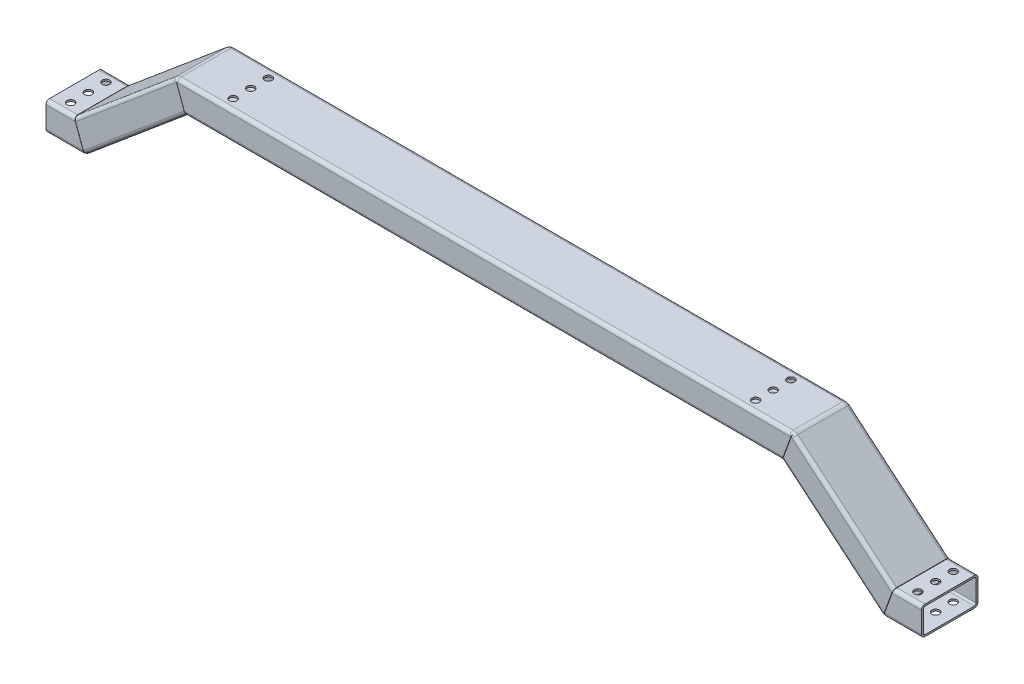
from build123d import *

# Parameters (mm, degrees)
FILLET1_R                    = 6.35
CUT_EXTRUDE_THIN1_DEPTH      = 405.410756534
CUT_EXTRUDE_THIN1_DEPTH_BACK = 405.410756534
F_1_4_CLEARANCE_HOLE1_D      = 6.7564


with BuildPart() as part:
    # Sweep-Thin1: sweep along a path in Sketch1
    with BuildLine(Plane.XY) as sweep_thin1_path:
        Line((-393.7, -76.2), (-363.677578025, -76.2))
        Line((-363.677578025, -76.2), (-272.865954269, 0))
        Line((-272.865954269, 0), (272.865954269, 0))
        Line((272.865954269, 0), (363.677578025, -76.2))
        Line((363.677578025, -76.2), (393.7, -76.2))
    # Sketch2 → Sweep-Thin1 (sweep)
    with BuildSketch(Plane(origin=(-393.7, 0, 0), x_dir=(0, 0, -1), z_dir=(1, 0, 0))):
        with BuildLine():
            Line((-22.225, -63.5), (22.225, -63.5))
            ThreePointArc((22.225, -63.5), (24.47006403, -64.42993597), (25.4, -66.675))
            Line((25.4, -66.675), (25.4, -85.725))
            ThreePointArc((25.4, -85.725), (24.47006403, -87.97006403), (22.225, -88.9))
            Line((22.225, -88.9), (-22.225, -88.9))
            ThreePointArc((-22.225, -88.9), (-24.47006403, -87.97006403), (-25.4, -85.725))
            Line((-25.4, -85.725), (-25.4, -66.675))
            ThreePointArc((-25.4, -66.675), (-24.47006403, -64.42993597), (-22.225, -63.5))
        make_face()
        with BuildLine():
            Line((-22.225, -65.0875), (22.225, -65.0875))
            ThreePointArc((22.225, -65.0875), (23.347532015, -65.552467985), (23.8125, -66.675))
            Line((23.8125, -66.675), (23.8125, -85.725))
            ThreePointArc((23.8125, -85.725), (23.347532015, -86.847532015), (22.225, -87.3125))
            Line((22.225, -87.3125), (-22.225, -87.3125))
            ThreePointArc((-22.225, -87.3125), (-23.347532015, -86.847532015), (-23.8125, -85.725))
            Line((-23.8125, -85.725), (-23.8125, -66.675))
            ThreePointArc((-23.8125, -66.675), (-23.347532015, -65.552467985), (-22.225, -65.0875))
        make_face(mode=Mode.SUBTRACT)
    sweep(path=sweep_thin1_path.line, transition=Transition.RIGHT)

    # Fillet1
    # the kernel refuses this fillet: 6.35 mm, written as the material it takes off along each edge
    with BuildSketch(Plane(origin=(-361.366367037, -82.55, 25.4), x_dir=(0, -1, 0), z_dir=(-1, 0, 0))) as fillet1_piece_1:
        with BuildLine():
            CenterArc((3.175, -3.175), 3.175, 0, 90)
            Line((6.35, -3.175), (6.35, 0))
            Line((6.35, 0), (3.175, 0))
        make_face()
    revolve(axis=Axis((-361.366367037, -82.55, 25.4), (0, 0, 1)), revolution_arc=40, mode=Mode.SUBTRACT)
    with BuildSketch(Plane(origin=(-361.366367037, -82.55, -25.4), x_dir=(0.6427876096865407, -0.7660444431189771, 0), z_dir=(0.7660444431189771, 0.6427876096865407, 0))) as fillet1_piece_2:
        with BuildLine():
            CenterArc((3.175, -3.175), 3.175, 0, 90)
            Line((6.35, -3.175), (6.35, 0))
            Line((6.35, 0), (3.175, 0))
        make_face()
    revolve(axis=Axis((-361.366367037, -82.55, -25.4), (0, 0, -1)), revolution_arc=40, mode=Mode.SUBTRACT)
    with BuildSketch(Plane(origin=(-275.177165257, 6.35, -25.4), x_dir=(-0.6427876096865407, 0.7660444431189771, 0), z_dir=(-0.7660444431189771, -0.6427876096865407, 0))) as fillet1_piece_3:
        with BuildLine():
            CenterArc((3.175, -3.175), 3.175, 0, 90)
            Line((6.35, -3.175), (6.35, 0))
            Line((6.35, 0), (3.175, 0))
        make_face()
    revolve(axis=Axis((-275.177165257, 6.35, -25.4), (0, 0, -1)), revolution_arc=40, mode=Mode.SUBTRACT)
    with BuildSketch(Plane(origin=(-275.177165257, 6.35, 25.4), x_dir=(0, 1, 0), z_dir=(1, 0, 0))) as fillet1_piece_4:
        with BuildLine():
            CenterArc((3.175, -3.175), 3.175, 0, 90)
            Line((6.35, -3.175), (6.35, 0))
            Line((6.35, 0), (3.175, 0))
        make_face()
    revolve(axis=Axis((-275.177165257, 6.35, 25.4), (0, 0, 1)), revolution_arc=40, mode=Mode.SUBTRACT)
    with BuildSketch(Plane(origin=(275.177165257, 6.35, -25.4), x_dir=(0, 1, 0), z_dir=(-1, 0, 0))) as fillet1_piece_5:
        with BuildLine():
            CenterArc((3.175, -3.175), 3.175, 0, 90)
            Line((6.35, -3.175), (6.35, 0))
            Line((6.35, 0), (3.175, 0))
        make_face()
    revolve(axis=Axis((275.177165257, 6.35, -25.4), (0, 0, -1)), revolution_arc=40, mode=Mode.SUBTRACT)
    with BuildSketch(Plane(origin=(275.177165257, 6.35, 25.4), x_dir=(0.6427876096865434, 0.7660444431189747, 0), z_dir=(0.7660444431189747, -0.6427876096865434, 0))) as fillet1_piece_6:
        with BuildLine():
            CenterArc((3.175, -3.175), 3.175, 0, 90)
            Line((6.35, -3.175), (6.35, 0))
            Line((6.35, 0), (3.175, 0))
        make_face()
    revolve(axis=Axis((275.177165257, 6.35, 25.4), (0, 0, 1)), revolution_arc=40, mode=Mode.SUBTRACT)
    with BuildSketch(Plane(origin=(361.366367037, -82.55, -25.4), x_dir=(0, -1, 0), z_dir=(1, 0, 0))) as fillet1_piece_7:
        with BuildLine():
            CenterArc((3.175, -3.175), 3.175, 0, 90)
            Line((6.35, -3.175), (6.35, 0))
            Line((6.35, 0), (3.175, 0))
        make_face()
    revolve(axis=Axis((361.366367037, -82.55, -25.4), (0, 0, -1)), revolution_arc=40, mode=Mode.SUBTRACT)
    with BuildSketch(Plane(origin=(361.366367037, -82.55, 25.4), x_dir=(-0.6427876096865434, -0.7660444431189747, 0), z_dir=(-0.7660444431189747, 0.6427876096865434, 0))) as fillet1_piece_8:
        with BuildLine():
            CenterArc((3.175, -3.175), 3.175, 0, 90)
            Line((6.35, -3.175), (6.35, 0))
            Line((6.35, 0), (3.175, 0))
        make_face()
    revolve(axis=Axis((361.366367037, -82.55, 25.4), (0, 0, 1)), revolution_arc=40, mode=Mode.SUBTRACT)
    with BuildSketch(Plane(origin=(-359.05515605, -88.9, -25.4), x_dir=(-1, 0, 0), z_dir=(0, 0, 1)), Plane(origin=(-277.488376244, 12.7, 25.4), x_dir=(-0.7660444431189755, -0.6427876096865425, 0), z_dir=(0, 0, -1)), Plane(origin=(277.488376244, 12.7, 25.4), x_dir=(-1, 0, 0), z_dir=(0, 0, -1)), Plane(origin=(359.05515605, -88.9, -25.4), x_dir=(-0.7660444431189726, 0.642787609686546, 0), z_dir=(0, 0, 1))) as fillet1_piece_9:
        with BuildLine():
            CenterArc((FILLET1_R * 0.363970234266, -FILLET1_R), FILLET1_R, 90, 40)
            Line((-FILLET1_R * 0.27881737542, -FILLET1_R * 0.233955556881), (0, 0))
            Line((0, 0), (FILLET1_R * 0.363970234266, 0))
        make_face()
    extrude(amount=50.8, mode=Mode.SUBTRACT)

    # Sketch3 → Cut-Extrude-Thin1 (cut, two sides: drawn at the far end of the back side and taken through both)
    with BuildSketch(Plane.XY.offset(-CUT_EXTRUDE_THIN1_DEPTH_BACK)):
        Polygon((-379.775333365, -32.343103858), (-359.752299759, -87.355936558), (-359.513617834, -87.269063442), (-379.536651439, -32.256230742), align=None)
        Polygon((-256.768198929, -43.856896142), (-276.791232535, 11.155936558), (-277.02991446, 11.069063442), (-257.006880855, -43.943769258), align=None)
        Polygon((276.791232535, 11.155936558), (256.768198929, -43.856896142), (257.006880855, -43.943769258), (277.02991446, 11.069063442), align=None)
        Polygon((379.536651439, -32.256230742), (359.513617834, -87.269063442), (359.752299759, -87.355936558), (379.775333365, -32.343103858), align=None)
    extrude(amount=CUT_EXTRUDE_THIN1_DEPTH + CUT_EXTRUDE_THIN1_DEPTH_BACK, mode=Mode.SUBTRACT)

    # 1/4 Clearance Hole1 (through all)
    with Locations(Plane(origin=(0, 12.7, 0), x_dir=(1, 0, 0), z_dir=(0, 1, 0))):
        with Locations((-234.95, 15.875), (-234.95, 0), (-234.95, -15.875), (-381, 15.875), (-381, 0), (-381, -15.875), (234.95, -15.875), (234.95, 0), (234.95, 15.875), (381, -15.875), (381, 0), (381, 15.875)):
            Hole(F_1_4_CLEARANCE_HOLE1_D / 2)


solid = part.part
